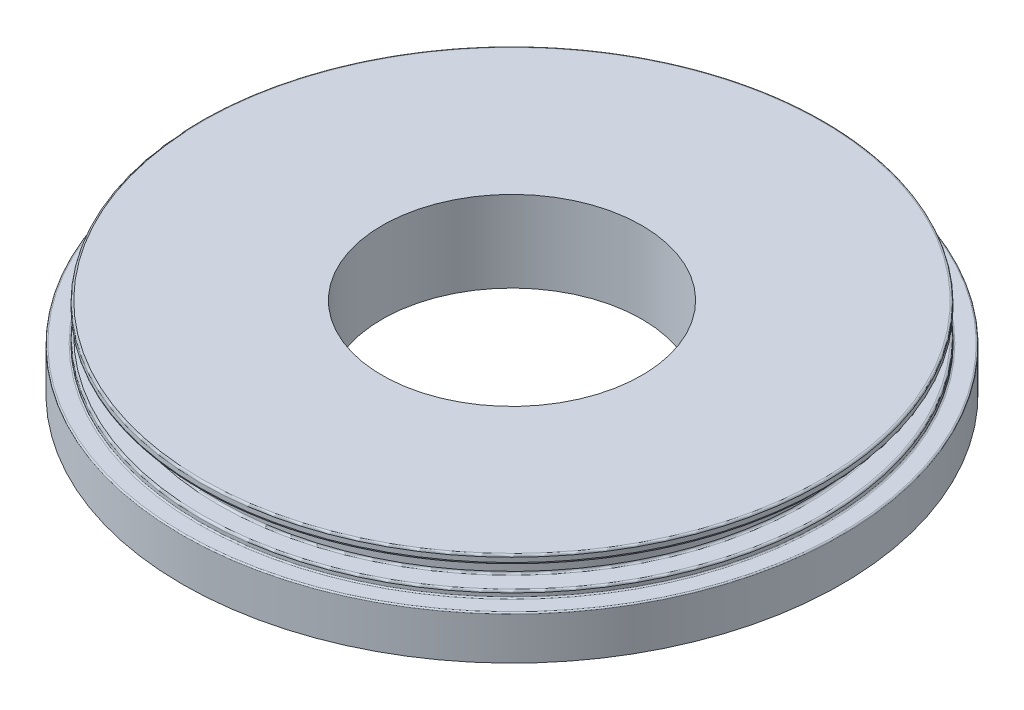
from build123d import *

# Parameters (mm, degrees)
FILLET2_R = 0.15
FILLET3_R = 0.15
FILLET4_R = 0.1
FILLET5_R = 0.15
FILLET6_R = 0.15


# Read off the part's stored shape, not the designer's step: Revolve1
with BuildPart() as part:
    # Revolve1 outline → Revolve1 (revolve)
    with BuildSketch(Plane.XY):
        Polygon((9.93, 6.204285714), (9.93, 0), (25.2, 0), (25.2, 3.34), (23.845556077, 3.34), (23.845556077, 3.84), (22.25, 3.84), (22.25, 5.554285714), (23.845556077, 5.554285714), (23.845556077, 6.204285714), align=None)
    revolve(axis=Axis((0, 0, 0), (0, 1, 0)))

    # Fillet2
    fillet2_edges = [part.edges().sort_by_distance(p)[0] for p in [
        (-23.845556077, 6.204285714, 0),
    ]]
    fillet(fillet2_edges, radius=FILLET2_R)

    # Fillet3
    fillet3_edges = [part.edges().sort_by_distance(p)[0] for p in [
        (-23.845556077, 5.554285714, 0),
        (-23.845556077, 3.84, 0),
    ]]
    fillet(fillet3_edges, radius=FILLET3_R)

    # Fillet4
    fillet4_edges = [part.edges().sort_by_distance(p)[0] for p in [
        (-23.845556077, 3.34, 0),
        (-25.2, 3.34, 0),
    ]]
    fillet(fillet4_edges, radius=FILLET4_R)

    # Fillet5
    fillet5_edges = [part.edges().sort_by_distance(p)[0] for p in [
        (-22.25, 3.84, 0),
    ]]
    fillet(fillet5_edges, radius=FILLET5_R)

    # Fillet6
    fillet6_edges = [part.edges().sort_by_distance(p)[0] for p in [
        (-22.25, 5.554285714, 0),
    ]]
    fillet(fillet6_edges, radius=FILLET6_R)


solid = part.part
